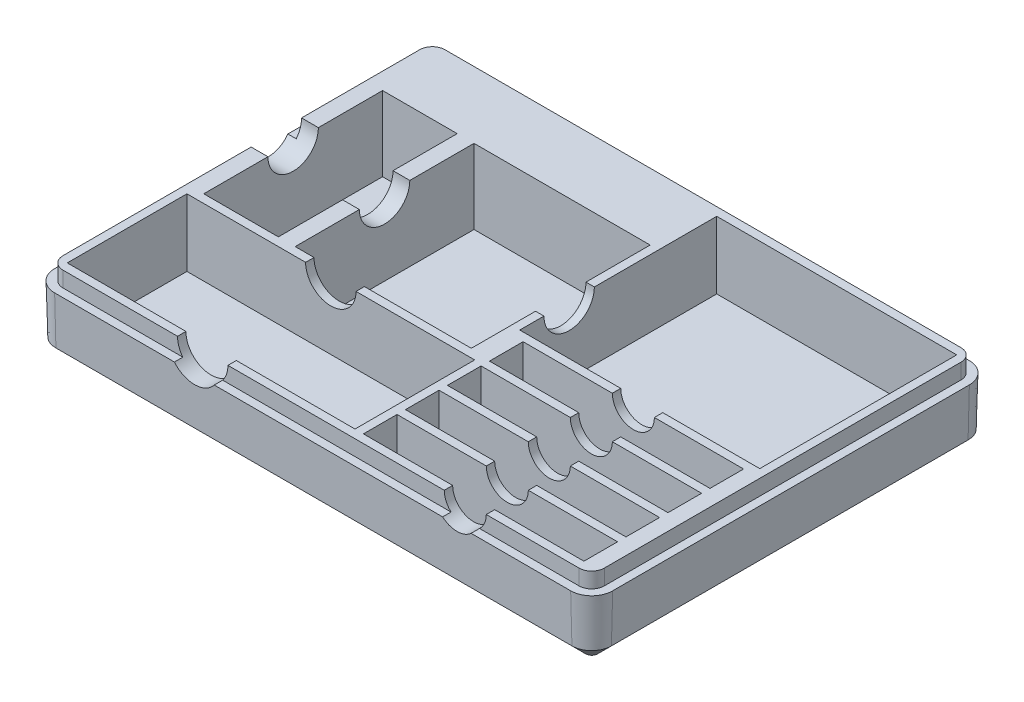
from build123d import *
from OCP.BRepFilletAPI import BRepFilletAPI_MakeChamfer

# Parameters (mm, degrees)
BOSS_EXTRUDE1_DEPTH            = 23.495
BOSS_EXTRUDE1_DRAFT            = -1.5
CHAMFER1_SIZE                  = 5.21838973
CHAMFER1_SIZE_2                = 5.08
BOSS_EXTRUDE2_DEPTH            = 5.842
SKETCH3_W                      = 108.712
SKETCH3_H                      = 45.212
CUT_EXTRUDE1_DEPTH             = 25.4
SKETCH4_R                      = 6.35
CUT_EXTRUDE2_DEPTH             = 1.524
CHAMFER2_SIZE2                 = 4.064
CHAMFER2_SIZE                  = 1.524
SKETCH5_W                      = 28.194
SKETCH5_H                      = 67.564
SKETCH5_W_2                    = 66.548
CUT_EXTRUDE3_DEPTH             = 28.194
SKETCH6_W                      = 83.312
SKETCH6_H                      = 12.7
CUT_EXTRUDE4_DEPTH             = 25.4
LPATTERN2_COUNT                = 4
LPATTERN2_PITCH                = 15.875
SKETCH8_W                      = 90.678
SKETCH8_H                      = 74.422
CUT_EXTRUDE5_DEPTH             = 25.4
CUT_EXTRUDE6_REACH             = 148.547
SKETCH10_R                     = 9.525
CUT_EXTRUDE6_DIRECTION_2_REACH = 148.547
SKETCH11_R                     = 9.525
CUT_EXTRUDE7_DEPTH             = 185.471292474
CUT_EXTRUDE7_DIRECTION_2_REACH = 186.471
CUT_EXTRUDE8_REACH             = 172.219
CUT_EXTRUDE8_DIRECTION_2_DEPTH = 171.218901151
SKETCH12_R                     = 5.067701835
CUT_EXTRUDE9_DEPTH             = 133.581735005


with BuildPart() as part:
    # Sketch1 → Boss-Extrude1 (with draft: the straight prism first)
    with BuildSketch(Plane(origin=(0, 0, 0), x_dir=(1, 0, 0), z_dir=(0, 1, 0))):
        with BuildLine():
            ThreePointArc((-97.4725, 75.311), (-103.085160076, 72.986160076), (-105.41, 67.3735))
            Line((-105.41, 67.3735), (-105.41, -67.3735))
            ThreePointArc((-105.41, -67.3735), (-103.085160076, -72.986160076), (-97.4725, -75.311))
            Line((-97.4725, -75.311), (97.4725, -75.311))
            ThreePointArc((97.4725, -75.311), (103.085160076, -72.986160076), (105.41, -67.3735))
            Line((105.41, -67.3735), (105.41, 67.3735))
            ThreePointArc((105.41, 67.3735), (103.085160076, 72.986160076), (97.4725, 75.311))
            Line((97.4725, 75.311), (-97.4725, 75.311))
        make_face()
    extrude(amount=-BOSS_EXTRUDE1_DEPTH)
    # Boss-Extrude1: the draft: its side faces are tilted about the plane it starts from
    boss_extrude1_sides = [part.faces().sort_by_distance(p)[0] for p in [
        (-103.085160076, -11.7475, -72.986160076),
        (-105.41, -11.7475, 0),
        (-103.085160076, -11.7475, 72.986160076),
        (0, -11.7475, 75.311),
        (103.085160076, -11.7475, 72.986160076),
        (105.41, -11.7475, 0),
        (103.085160076, -11.7475, -72.986160076),
        (0, -11.7475, -75.311),
    ]]
    draft(boss_extrude1_sides, Plane(origin=(0, 0, 0), x_dir=(1, 0, 0), z_dir=(0, 1, 0)), BOSS_EXTRUDE1_DRAFT)

    # Chamfer1
    chamfer1_edges_1 = [part.edges().sort_by_distance(p)[0] for p in [
        (-102.650120953, -23.495, -72.551120953),
    ]]
    chamfer1_side_1 = [part.faces().sort_by_distance(p)[0] for p in [
        (-102.652001559, -23.393434816, -72.553001559),
    ]]
    chamfer1_edges_2 = [part.edges().sort_by_distance(p)[0] for p in [
        (-104.794761773, -23.495, 0),
    ]]
    chamfer1_side_2 = [part.faces().sort_by_distance(p)[0] for p in [
        (-104.797421351, -23.393434816, 0),
    ]]
    chamfer1_edges_3 = [part.edges().sort_by_distance(p)[0] for p in [
        (-102.650120953, -23.495, 72.551120953),
    ]]
    chamfer1_side_3 = [part.faces().sort_by_distance(p)[0] for p in [
        (-102.652001559, -23.393434816, 72.553001559),
    ]]
    chamfer1_edges_4 = [part.edges().sort_by_distance(p)[0] for p in [
        (0, -23.495, 74.695761773),
    ]]
    chamfer1_side_4 = [part.faces().sort_by_distance(p)[0] for p in [
        (0, -23.393434816, 74.698421351),
    ]]
    chamfer1_edges_5 = [part.edges().sort_by_distance(p)[0] for p in [
        (102.650120953, -23.495, 72.551120953),
    ]]
    chamfer1_side_5 = [part.faces().sort_by_distance(p)[0] for p in [
        (102.652001559, -23.393434816, 72.553001559),
    ]]
    chamfer1_edges_6 = [part.edges().sort_by_distance(p)[0] for p in [
        (104.794761773, -23.495, 0),
    ]]
    chamfer1_side_6 = [part.faces().sort_by_distance(p)[0] for p in [
        (104.797421351, -23.393434816, 0),
    ]]
    chamfer1_edges_7 = [part.edges().sort_by_distance(p)[0] for p in [
        (102.650120953, -23.495, -72.551120953),
    ]]
    chamfer1_side_7 = [part.faces().sort_by_distance(p)[0] for p in [
        (102.652001559, -23.393434816, -72.553001559),
    ]]
    chamfer1_edges_8 = [part.edges().sort_by_distance(p)[0] for p in [
        (0, -23.495, -74.695761773),
    ]]
    chamfer1_side_8 = [part.faces().sort_by_distance(p)[0] for p in [
        (0, -23.393434816, -74.698421351),
    ]]
    chamfer1 = BRepFilletAPI_MakeChamfer(part.part.solid().wrapped)
    for e in chamfer1_edges_1:
        chamfer1.Add(CHAMFER1_SIZE, CHAMFER1_SIZE_2, e.wrapped, chamfer1_side_1[0].wrapped)
    for e in chamfer1_edges_2:
        chamfer1.Add(CHAMFER1_SIZE, CHAMFER1_SIZE_2, e.wrapped, chamfer1_side_2[0].wrapped)
    for e in chamfer1_edges_3:
        chamfer1.Add(CHAMFER1_SIZE, CHAMFER1_SIZE_2, e.wrapped, chamfer1_side_3[0].wrapped)
    for e in chamfer1_edges_4:
        chamfer1.Add(CHAMFER1_SIZE, CHAMFER1_SIZE_2, e.wrapped, chamfer1_side_4[0].wrapped)
    for e in chamfer1_edges_5:
        chamfer1.Add(CHAMFER1_SIZE_2, CHAMFER1_SIZE, e.wrapped, chamfer1_side_5[0].wrapped)
    for e in chamfer1_edges_6:
        chamfer1.Add(CHAMFER1_SIZE, CHAMFER1_SIZE_2, e.wrapped, chamfer1_side_6[0].wrapped)
    for e in chamfer1_edges_7:
        chamfer1.Add(CHAMFER1_SIZE, CHAMFER1_SIZE_2, e.wrapped, chamfer1_side_7[0].wrapped)
    for e in chamfer1_edges_8:
        chamfer1.Add(CHAMFER1_SIZE, CHAMFER1_SIZE_2, e.wrapped, chamfer1_side_8[0].wrapped)
    add(Compound.cast(chamfer1.Shape()), mode=Mode.REPLACE)

    # Sketch2 → Boss-Extrude2 (add)
    with BuildSketch(Plane(origin=(0, 0, 0), x_dir=(1, 0, 0), z_dir=(0, 1, 0))):
        with BuildLine():
            Line((97.4725, 72.136), (-97.4725, 72.136))
            ThreePointArc((-97.4725, 72.136), (-100.840096045, 70.741096045), (-102.235, 67.3735))
            Line((-102.235, 67.3735), (-102.235, -67.3735))
            ThreePointArc((-102.235, -67.3735), (-100.840096045, -70.741096045), (-97.4725, -72.136))
            Line((-97.4725, -72.136), (97.4725, -72.136))
            ThreePointArc((97.4725, -72.136), (100.840096045, -70.741096045), (102.235, -67.3735))
            Line((102.235, -67.3735), (102.235, 67.3735))
            ThreePointArc((102.235, 67.3735), (100.840096045, 70.741096045), (97.4725, 72.136))
        make_face()
    extrude(amount=BOSS_EXTRUDE2_DEPTH)

    # Sketch3 → Cut-Extrude1 (cut)
    with BuildSketch(Plane(origin=(0, 5.842, 0), x_dir=(1, 0, 0), z_dir=(0, 1, 0))):
        with Locations((-44.704, -46.355)):
            Rectangle(SKETCH3_W, SKETCH3_H)
    extrude(amount=-CUT_EXTRUDE1_DEPTH, mode=Mode.SUBTRACT)

    # Sketch4 → Cut-Extrude2 (cut)
    with BuildSketch(Plane.XZ.offset(23.495)):
        with Locations(Location((0, 0, 0), (0, 0, 270))):
            Circle(SKETCH4_R)
    extrude(amount=-CUT_EXTRUDE2_DEPTH, mode=Mode.SUBTRACT)

    # Chamfer2
    chamfer2_edges = [part.edges().sort_by_distance(p)[0] for p in [
        (0, -21.971, 6.35),
    ]]
    chamfer2_side = [part.faces().sort_by_distance(p)[0] for p in [
        (0, -22.00148, 6.35),
    ]]
    chamfer(chamfer2_edges, length=CHAMFER2_SIZE - 0.0001, length2=CHAMFER2_SIZE2 - 0.0001, reference=chamfer2_side[0])  # a hair under: the kernel refuses the full size

    # Sketch5 → Cut-Extrude3 (cut)
    with BuildSketch(Plane(origin=(0, 5.842, 0), x_dir=(1, 0, 0), z_dir=(0, 1, 0))):
        with Locations((-81.788, 13.208)):
            Rectangle(SKETCH5_W, SKETCH5_H)
        with Locations((-28.067, 13.208)):
            Rectangle(SKETCH5_W_2, SKETCH5_H)
    extrude(amount=-CUT_EXTRUDE3_DEPTH, mode=Mode.SUBTRACT)

    # Sketch6 → Cut-Extrude4 (cut)
    with BuildSketch(Plane(origin=(0, 5.842, 0), x_dir=(1, 0, 0), z_dir=(0, 1, 0))):
        with Locations((54.483, -62.611)):
            Rectangle(SKETCH6_W, SKETCH6_H)
    cut_extrude4 = extrude(amount=-CUT_EXTRUDE4_DEPTH, mode=Mode.SUBTRACT)

    # LPattern2: Cut-Extrude4 ×4
    with Locations(*[(0, 0, -i * LPATTERN2_PITCH) for i in range(1, LPATTERN2_COUNT)]):
        add(cut_extrude4, mode=Mode.SUBTRACT)

    # Sketch8 → Cut-Extrude5 (cut)
    with BuildSketch(Plane(origin=(0, 5.842, 0), x_dir=(1, 0, 0), z_dir=(0, 1, 0))):
        with Locations((53.721, 31.75)):
            Rectangle(SKETCH8_W, SKETCH8_H)
    extrude(amount=-CUT_EXTRUDE5_DEPTH, mode=Mode.SUBTRACT)

    # Sketch10 → Cut-Extrude6 (cut, up to next)
    with BuildSketch(Plane.XY.offset(23.749), mode=Mode.PRIVATE) as cut_extrude6_sk1:
        with Locations((-44.704, 5.842)):
            Circle(SKETCH10_R)
    cut_extrude6_tool1 = extrude(cut_extrude6_sk1.sketch, amount=-CUT_EXTRUDE6_REACH, mode=Mode.PRIVATE) & part.part
    add(cut_extrude6_tool1.solids().sort_by_distance((-44.704, 5.842, 23.749))[0], mode=Mode.SUBTRACT)

    # Sketch10 → Cut-Extrude6 direction 2 (cut, up to next)
    with BuildSketch(Plane.XY.offset(23.749), mode=Mode.PRIVATE) as cut_extrude6_direction_2_sk1:
        with Locations((-44.704, 5.842)):
            Circle(SKETCH10_R)
    cut_extrude6_direction_2_tool1 = extrude(cut_extrude6_direction_2_sk1.sketch, amount=CUT_EXTRUDE6_DIRECTION_2_REACH, mode=Mode.PRIVATE) & part.part
    add(cut_extrude6_direction_2_tool1.solids().sort_by_distance((-44.704, 5.842, 23.749))[0], mode=Mode.SUBTRACT)

    # Sketch11 → Cut-Extrude7 (cut)
    with BuildSketch(Plane(origin=(-61.341, 0, 0), x_dir=(0, 0, -1), z_dir=(1, 0, 0))):
        with Locations((13.208, 5.842)):
            Circle(SKETCH11_R)
    extrude(amount=-CUT_EXTRUDE7_DEPTH, mode=Mode.SUBTRACT)

    # Sketch11 → Cut-Extrude7 direction 2 (cut, up to next)
    with BuildSketch(Plane(origin=(-61.341, 0, 0), x_dir=(0, 0, -1), z_dir=(1, 0, 0)), mode=Mode.PRIVATE) as cut_extrude7_direction_2_sk1:
        with Locations((13.208, 5.842)):
            Circle(SKETCH11_R)
    cut_extrude7_direction_2_tool1 = extrude(cut_extrude7_direction_2_sk1.sketch, amount=CUT_EXTRUDE7_DIRECTION_2_REACH, mode=Mode.PRIVATE) & part.part
    add(cut_extrude7_direction_2_tool1.solids().sort_by_distance((-61.341, 5.842, -13.208))[0], mode=Mode.SUBTRACT)

    # Cut-Extrude8: up to this face of the body (flat: up to its plane)
    cut_extrude8_end = Plane(part.part.faces().sort_by_distance((53.721, -6.858, 5.461))[0])
    # Sketch7 → Cut-Extrude8 (cut, up to the picked face)
    with BuildSketch(Plane.XY.offset(56.261), mode=Mode.PRIVATE) as cut_extrude8_sk1:
        with BuildLine():
            Line((46.5455, 5.842), (54.483, 5.842))
            Line((54.483, 5.842), (62.4205, 5.842))
            ThreePointArc((62.4205, 5.842), (54.483, -2.0955), (46.5455, 5.842))
        make_face()
    cut_extrude8_tool1 = split(extrude(cut_extrude8_sk1.sketch, amount=-CUT_EXTRUDE8_REACH, mode=Mode.PRIVATE), bisect_by=cut_extrude8_end, keep=Keep.BOTH, mode=Mode.PRIVATE)
    add(cut_extrude8_tool1.solids().sort_by(Axis((54.483, 2.47322, 56.261), (0, 0, -1)))[0], mode=Mode.SUBTRACT)

    # Sketch7 → Cut-Extrude8 direction 2 (cut)
    with BuildSketch(Plane.XY.offset(56.261)):
        with BuildLine():
            Line((46.5455, 5.842), (54.483, 5.842))
            Line((54.483, 5.842), (62.4205, 5.842))
            ThreePointArc((62.4205, 5.842), (54.483, -2.0955), (46.5455, 5.842))
        make_face()
    extrude(amount=CUT_EXTRUDE8_DIRECTION_2_DEPTH, mode=Mode.SUBTRACT)

    # Sketch12 → Cut-Extrude9 (cut, through all)
    with BuildSketch(Plane(origin=(0, -22.352, 0), x_dir=(1, 0, 0), z_dir=(0, 1, 0))):
        with Locations(Location((0, 0, 0), (0, 0, 270))):
            Circle(SKETCH12_R)
    extrude(amount=-CUT_EXTRUDE9_DEPTH, mode=Mode.SUBTRACT)


solid = part.part
